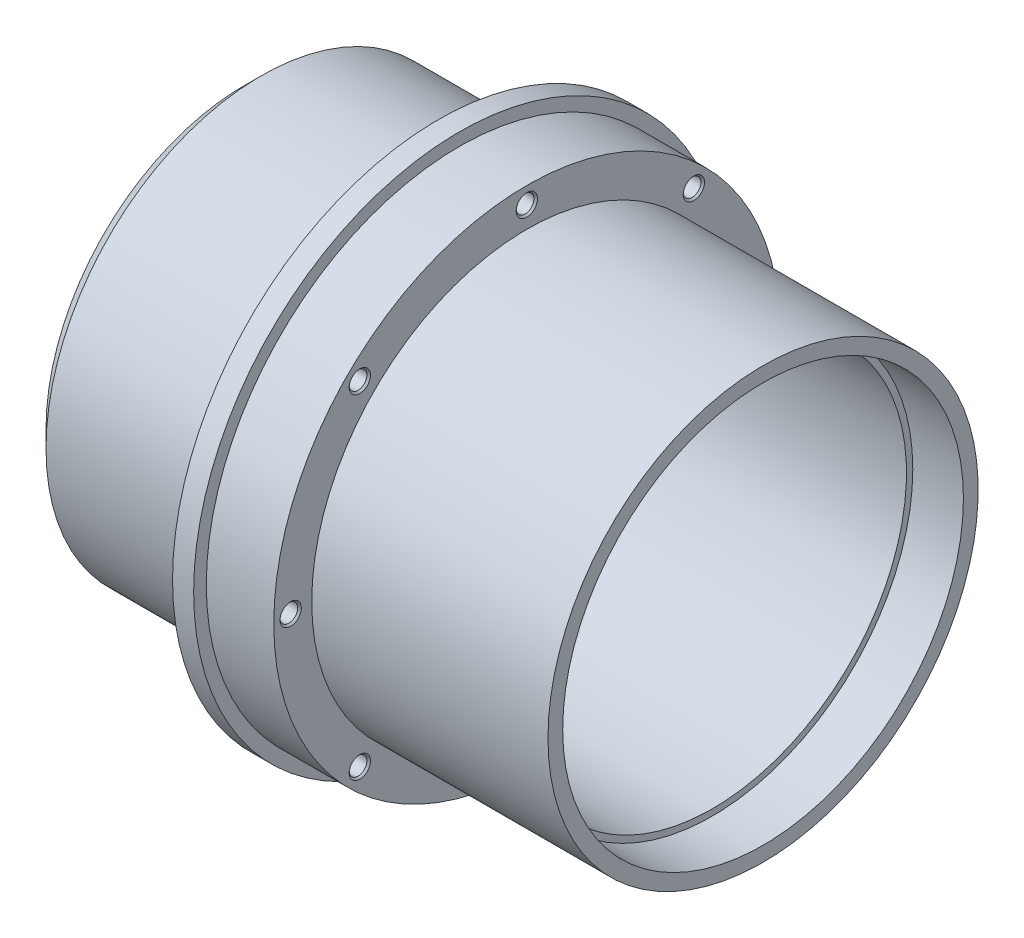
from build123d import *

# Parameters (mm, degrees)
OTW_R_GWINTOWANY_M51_D           = 4.2
OTW_R_GWINTOWANY_M51_CSINK_D     = 5.05
OTW_R_GWINTOWANY_M51_CSINK_ANGLE = 90


with BuildPart() as part:
    # Szkic1 → Obrót1 (revolve)
    with BuildSketch(Plane.XY):
        Polygon((12, 40), (12, 12.010834691), (0, 12.010834691), (0, 47), (4, 51), (44.000000091, 51), (46.000000091, 52.999999793), (46.000000091, 63), (51.000000091, 63), (51.000000091, 60), (67.000000091, 60), (67.000000091, 50.999999793), (123, 50.999999793), (123, 47.5), (111, 47.5), (111, 46), (36.5, 46), (36.5, 45), (24.5, 45), (24.5, 42), (14, 42), align=None)
    revolve(axis=Axis((0, 0, 0), (1, 0, 0)))

    # Otwór gwintowany M51 (through all)
    with Locations(Plane(origin=(67.000000091, 0, 0), x_dir=(0, 0, -1), z_dir=(1, 0, 0))):
        with Locations((0, 56), (39.597979746, 39.597979746), (56, 0), (39.597979746, -39.597979746), (0, -56), (-39.597979746, -39.597979746), (-56, 0), (-39.597979746, 39.597979746), (0, 0)):
            CounterSinkHole(OTW_R_GWINTOWANY_M51_D / 2, OTW_R_GWINTOWANY_M51_CSINK_D / 2, counter_sink_angle=OTW_R_GWINTOWANY_M51_CSINK_ANGLE)


solid = part.part
